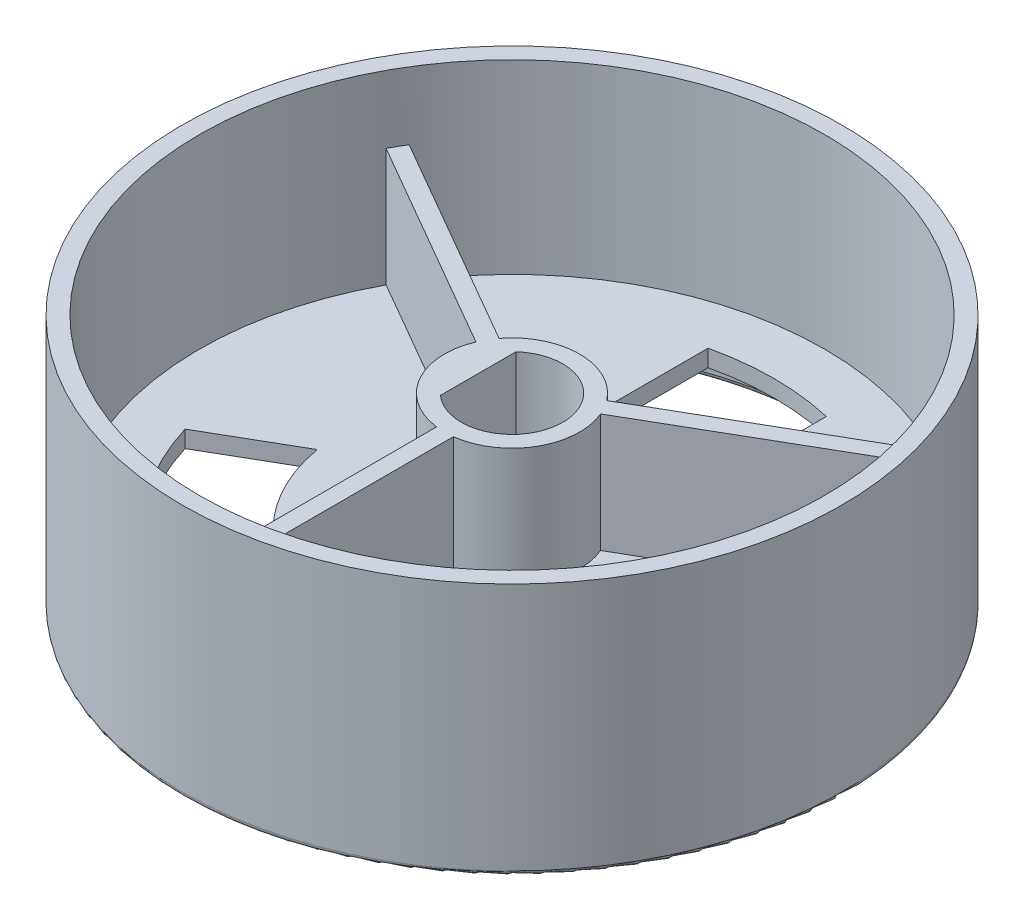
from build123d import *
from build123d.topology import SkipClean

# Parameters (mm, degrees)
SKETCH1_R            = 19.5
SKETCH1_R_2          = 18.5
BOSS_EXTRUDE1_DEPTH  = 15
SKETCH2_R            = 18.5
BOSS_EXTRUDE2_DEPTH  = 4
SKETCH3_R            = 18.5
CUT_EXTRUDE1_DEPTH   = 3
CUT_EXTRUDE2_DEPTH   = 3
CIRPATTERN1_COUNT    = 3
SKETCH8_R            = 4
BOSS_EXTRUDE28_DEPTH = 8
CUT_EXTRUDE3_DEPTH   = 8
SKETCH11_W           = 1
SKETCH11_H           = 15.24098
BOSS_EXTRUDE29_DEPTH = 8
CIRPATTERN5_COUNT    = 3
SKETCH12_W           = 1
SKETCH12_H           = 6.224425
BOSS_EXTRUDE30_DEPTH = 8
FILLET7_R            = 0.5
FILLET8_R            = 0.3


with BuildPart() as part:
    # Sketch1 → Boss-Extrude1 (new body)
    with BuildSketch(Plane(origin=(0, 0, 0), x_dir=(1, 0, 0), z_dir=(0, 1, 0))):
        with Locations(Location((0, 0, 0), (0, 0, 270))):
            Circle(SKETCH1_R)
        with Locations(Location((0, 0, 0), (0, 0, 270))):
            Circle(SKETCH1_R_2, mode=Mode.SUBTRACT)
    extrude(amount=BOSS_EXTRUDE1_DEPTH)

    # Sketch2 → Boss-Extrude2 (add)
    with BuildSketch(Plane(origin=(0, 0, 0), x_dir=(1, 0, 0), z_dir=(0, 1, 0))):
        with Locations(Location((0, 0, 0), (0, 0, 270))):
            Circle(SKETCH2_R)
    extrude(amount=BOSS_EXTRUDE2_DEPTH)

    # Sketch3 → Cut-Extrude1 (cut)
    with BuildSketch(Plane(origin=(0, 0, 0), x_dir=(-1, 0, 0), z_dir=(0, -1, 0))):
        with Locations(Location((0, 0, 0), (0, 0, 270))):
            Circle(SKETCH3_R)
    extrude(amount=-CUT_EXTRUDE1_DEPTH, mode=Mode.SUBTRACT)

    # Sketch6 → Cut-Extrude2 (cut)
    with BuildSketch(Plane(origin=(0, 3, 0), x_dir=(-1, 0, 0), z_dir=(0, -1, 0))):
        with BuildLine():
            ThreePointArc((-3.434212, 9.391815), (-1.743825, 9.84678), (0, 10))
            Line((0, 10), (0, 15.5))
            ThreePointArc((0, 15.5), (-1.76141, 15.399592), (-3.5, 15.099669))
            Line((-3.5, 15.099669), (-3.5, 9.391815))
            Line((-3.5, 9.391815), (-3.434212, 9.391815))
        make_face()
        with BuildLine():
            Line((0, 15.5), (0, 10))
            ThreePointArc((0, 10), (1.743825, 9.84678), (3.434212, 9.391815))
            Line((3.434212, 9.391815), (3.5, 9.391815))
            Line((3.5, 9.391815), (3.5, 15.099669))
            ThreePointArc((3.5, 15.099669), (1.76141, 15.399592), (0, 15.5))
        make_face()
    cut_extrude2 = extrude(amount=-CUT_EXTRUDE2_DEPTH, mode=Mode.SUBTRACT)

    # CirPattern1: Cut-Extrude2 ×3 about axis
    cirpattern1_axis = Axis((0, 0, 0), (0, 1, 0))
    for i in range(1, CIRPATTERN1_COUNT):
        add(cut_extrude2.rotate(cirpattern1_axis, i * 360 / CIRPATTERN1_COUNT), mode=Mode.SUBTRACT)

    # Sketch8 → Boss-Extrude28 (add)
    with BuildSketch(Plane.XZ.offset(-3)):
        with Locations(Location((0, 0, 0), (0, 0, 270))):
            Circle(SKETCH8_R)
        with BuildLine():
            Line((-2, -2.236068), (-2, 2.236068))
            ThreePointArc((-2, 2.236068), (3, 0), (-2, -2.236068))
        make_face(mode=Mode.SUBTRACT)
    extrude(amount=-BOSS_EXTRUDE28_DEPTH)

    # Sketch8<3> → Cut-Extrude3 (cut)
    with SkipClean():  # the faces are left unmerged after this step: merging them gives an invalid solid
        with BuildSketch(Plane.XZ.offset(-3)):
            with BuildLine():
                ThreePointArc((3, 0), (1.224745, 2.738613), (-2, 2.236068))
                Line((-2, 2.236068), (-2, -2.236068))
                ThreePointArc((-2, -2.236068), (1.224745, -2.738613), (3, 0))
            make_face()
        extrude(amount=-CUT_EXTRUDE3_DEPTH, mode=Mode.SUBTRACT)

    # Sketch11 → Boss-Extrude29 (add)
    with SkipClean():  # the faces are left unmerged after this step: merging them gives an invalid solid
        with BuildSketch(Plane(origin=(0, 11, 0), x_dir=(1, 0, 0), z_dir=(0, 1, 0))):
            with Locations((0, -11.25)):
                Rectangle(SKETCH11_W, SKETCH11_H)
        boss_extrude29 = extrude(amount=-BOSS_EXTRUDE29_DEPTH)

    # CirPattern5: Boss-Extrude29 ×3 about axis
    with SkipClean():  # the faces are left unmerged after this step: merging them gives an invalid solid
        cirpattern5_axis = Axis((0, 0, 0), (0, 1, 0))
        for i in range(1, CIRPATTERN5_COUNT):
            add(boss_extrude29.rotate(cirpattern5_axis, i * 360 / CIRPATTERN5_COUNT))

    # Sketch12 → Boss-Extrude30 (add)
    with SkipClean():  # the faces are left unmerged after this step: merging them gives an invalid solid
        with BuildSketch(Plane.XZ):
            with Locations((0, 15.612213)):
                Rectangle(SKETCH12_W, SKETCH12_H)
        extrude(amount=-BOSS_EXTRUDE30_DEPTH)

    # Fillet7
    fillet7_edges = [part.edges().sort_by_distance(p)[0] for p in [
        (-0.5, 1.5, 12.5),
        (0.5, 1.5, 12.5),
    ]]
    fillet(fillet7_edges, radius=FILLET7_R - 0.0001)  # a hair under: the kernel refuses the full size

    # Fillet8
    fillet8_edges = [part.edges().sort_by_distance(p)[0] for p in [
        (0, 0, -19.5),
        (0, 0, -18.5),
        (-0.5, 0, 15.746571),
        (0.5, 0, 15.746571),
        (0.353583, 0, 12.646417),
        (-0.353583, 0, 12.646417),
    ]]
    fillet(fillet8_edges, radius=FILLET8_R)


solid = part.part
